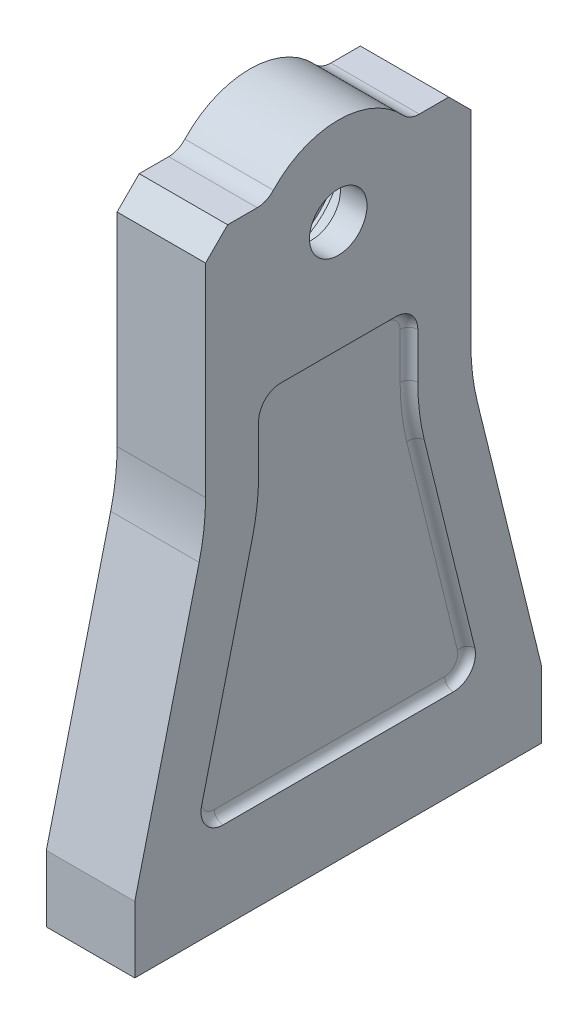
from build123d import *

# Parameters (mm, degrees)
SKETCH1_R            = 6.5
BOSS_EXTRUDE1_DEPTH  = 10
CUT_EXTRUDE1_DEPTH   = 2
FILLET1_R            = 2
FILLET1_OF_MIRROR4_R = 2
FILLET2_R            = 50
SKETCH3_R            = 3
CUT_EXTRUDE2_DEPTH   = 10
SKETCH4_R            = 15
CUT_EXTRUDE3_DEPTH   = 14
CHAMFER1_SIZE        = 1
CUT_EXTRUDE4_START   = -6
SKETCH5_R            = 16
CUT_EXTRUDE4_DEPTH   = 1.5


with BuildPart() as part:
    # Sketch1 → Boss-Extrude1 (new, symmetric)
    with BuildSketch(Plane(origin=(0, 0, 0), x_dir=(0, 0, -1), z_dir=(1, 0, 0))):
        with BuildLine():
            Line((-46, -11.205497968), (46, -11.205497968))
            Line((46, -11.205497968), (46, 3.794502032))
            Line((46, 3.794502032), (30, 68.794502032))
            Line((30, 68.794502032), (30, 120.794502032))
            Line((30, 120.794502032), (25, 125.794502032))
            Line((25, 125.794502032), (18.33030278, 125.794502032))
            ThreePointArc((18.33030278, 125.794502032), (16.33030278, 126.211926337), (14.664242224, 127.394502032))
            ThreePointArc((14.664242224, 127.394502032), (0, 133.794502032), (-14.664242224, 127.394502032))
            ThreePointArc((-14.664242224, 127.394502032), (-16.33030278, 126.211926337), (-18.33030278, 125.794502032))
            Line((-18.33030278, 125.794502032), (-25, 125.794502032))
            Line((-25, 125.794502032), (-30, 120.794502032))
            Line((-30, 120.794502032), (-30, 68.794502032))
            Line((-30, 68.794502032), (-46, 3.794502032))
            Line((-46, 3.794502032), (-46, -11.205497968))
        make_face()
        with Locations((0, 113.794502032)):
            Circle(SKETCH1_R, mode=Mode.SUBTRACT)
    extrude(amount=BOSS_EXTRUDE1_DEPTH, both=True)

    # Sketch2 → Cut-Extrude1 (cut, symmetric)
    with BuildSketch(Plane(origin=(10, 0, 0), x_dir=(0, 0, -1), z_dir=(1, 0, 0))):
        with BuildLine():
            Line((13, 88.794502032), (-13, 88.794502032))
            ThreePointArc((-13, 88.794502032), (-16.535533906, 87.330035938), (-18, 83.794502032))
            Line((-18, 83.794502032), (-18, 73.402647758))
            ThreePointArc((-18, 73.402647758), (-18.363636327, 67.383395202), (-19.449256053, 61.451695402))
            Line((-19.449256053, 61.451695402), (-30.886080209, 14.989597267))
            ThreePointArc((-30.886080209, 14.989597267), (-29.966452179, 10.710306527), (-26.031005815, 8.794502032))
            Line((-26.031005815, 8.794502032), (26.031005815, 8.794502032))
            ThreePointArc((26.031005815, 8.794502032), (29.966452179, 10.710306527), (30.886080209, 14.989597267))
            Line((30.886080209, 14.989597267), (19.449256053, 61.451695402))
            ThreePointArc((19.449256053, 61.451695402), (18.363636327, 67.383395202), (18, 73.402647758))
            Line((18, 73.402647758), (18, 83.794502032))
            ThreePointArc((18, 83.794502032), (16.535533906, 87.330035938), (13, 88.794502032))
        make_face()
    cut_extrude1 = extrude(amount=CUT_EXTRUDE1_DEPTH, both=True, mode=Mode.SUBTRACT)

    # Fillet1
    fillet1_edges = [part.edges().sort_by_distance(p)[0] for p in [
        (8, 38.220646335, 25.167668131),
        (8, 67.383395202, 18.363636327),
        (8, 78.598574895, 18),
        (8, 87.330035938, 16.535533906),
        (8, 88.794502032, 0),
        (8, 87.330035938, -16.535533906),
        (8, 78.598574895, -18),
        (8, 67.383395202, -18.363636327),
        (8, 38.220646335, -25.167668131),
        (8, 10.710306527, -29.966452179),
        (8, 8.794502032, 0),
        (8, 10.710306527, 29.966452179),
    ]]
    fillet(fillet1_edges, radius=FILLET1_R - 0.0001)  # a hair under: the kernel refuses the full size

    # Mirror4: Cut-Extrude1 across plane
    add(cut_extrude1.mirror(Plane(origin=(0, 0, 0), x_dir=(0, 0, 1), z_dir=(1, 0, 0))), mode=Mode.SUBTRACT)

    # Fillet1 of Mirror4
    fillet1_of_mirror4_edges = [part.edges().sort_by_distance(p)[0] for p in [
        (-8, 38.220646335, 25.167668131),
        (-8, 67.383395202, 18.363636327),
        (-8, 78.598574895, 18),
        (-8, 87.330035938, 16.535533906),
        (-8, 88.794502032, 0),
        (-8, 87.330035938, -16.535533906),
        (-8, 78.598574895, -18),
        (-8, 67.383395202, -18.363636327),
        (-8, 38.220646335, -25.167668131),
        (-8, 10.710306527, -29.966452179),
        (-8, 8.794502032, 0),
        (-8, 10.710306527, 29.966452179),
    ]]
    fillet(fillet1_of_mirror4_edges, radius=FILLET1_OF_MIRROR4_R - 0.0001)  # a hair under: the kernel refuses the full size

    # Fillet2
    fillet2_edges = [part.edges().sort_by_distance(p)[0] for p in [
        (0, 68.794502032, 30),
        (0, 68.794502032, -30),
    ]]
    fillet(fillet2_edges, radius=FILLET2_R)

    # Sketch3 → Cut-Extrude2 (cut)
    with BuildSketch(Plane.XZ.offset(11.205497968)):
        with Locations(Location((0, 30, 0), (0, 0, 270))):
            Circle(SKETCH3_R)
        with Locations(Location((0, -30, 0), (0, 0, 270))):
            Circle(SKETCH3_R)
    extrude(amount=-CUT_EXTRUDE2_DEPTH, mode=Mode.SUBTRACT)

    # Sketch4 → Cut-Extrude3 (cut)
    with BuildSketch(Plane.ZY.offset(10)):
        with Locations((0, 113.794502032)):
            Circle(SKETCH4_R)
    extrude(amount=-CUT_EXTRUDE3_DEPTH, mode=Mode.SUBTRACT)

    # Chamfer1
    chamfer1_edges = [part.edges().sort_by_distance(p)[0] for p in [
        (-10, 113.794502032, -15),
    ]]
    chamfer(chamfer1_edges, length=CHAMFER1_SIZE)

    # Sketch5 → Cut-Extrude4 (cut)
    with BuildSketch(Plane.ZY.offset(10).offset(CUT_EXTRUDE4_START)):
        with Locations((0, 113.794502032)):
            Circle(SKETCH5_R)
    extrude(amount=CUT_EXTRUDE4_DEPTH, mode=Mode.SUBTRACT)


solid = part.part
